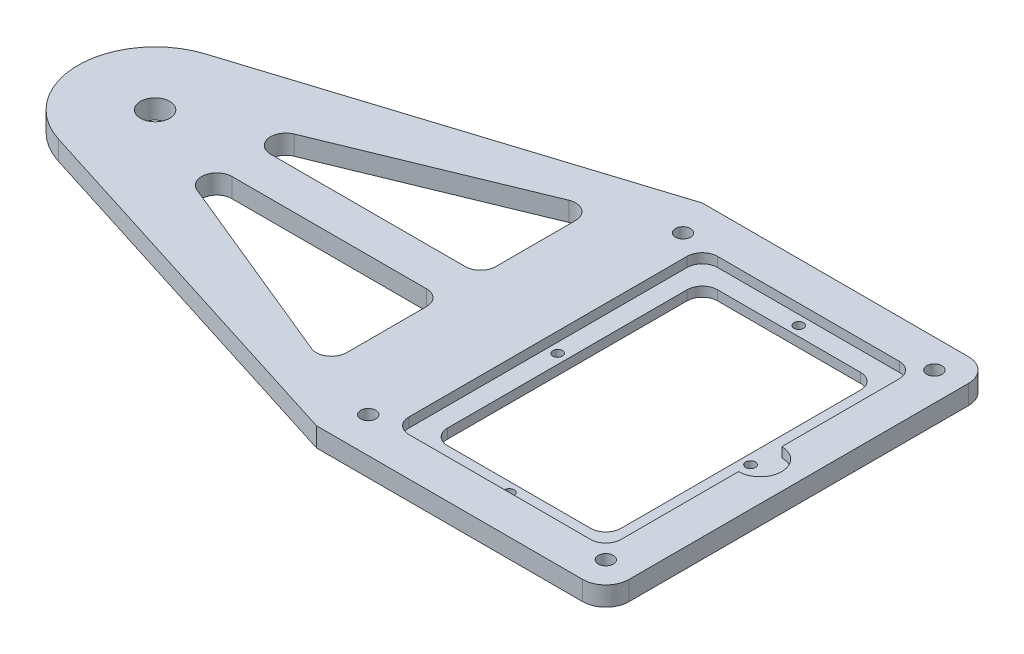
from build123d import *

# Parameters (mm, degrees)
SKETCH1_W           = 95.25
SKETCH1_H           = 127
BOSS_EXTRUDE1_DEPTH = 6.35
BOSS_EXTRUDE3_DEPTH = 6.35
SKETCH5_R           = 4.826
CUT_EXTRUDE1_DEPTH  = 201.11039673
CUT_EXTRUDE2_DEPTH  = 201.11039673
FILLET9_R           = 5
SKETCH7_R           = 5.453804141
BOSS_EXTRUDE4_DEPTH = 6.35
SKETCH8_W           = 69.85
SKETCH8_H           = 101.6
CUT_EXTRUDE3_DEPTH  = 3.175
SKETCH9_W           = 57.15
SKETCH9_H           = 88.9
CUT_EXTRUDE4_DEPTH  = 201.03481948
SKETCH11_R          = 1.5875
CUT_EXTRUDE6_DEPTH  = 201.03481948
CUT_EXTRUDE7_DEPTH  = 3.175
FILLET10_R          = 5
FILLET11_R          = 5
FILLET12_R          = 7.62
SKETCH13_R          = 2.4892
CUT_EXTRUDE8_DEPTH  = 201.11039673


with BuildPart() as part:
    # Sketch1 → Boss-Extrude1 (new body)
    with BuildSketch(Plane(origin=(0, 0, 0), x_dir=(1, 0, 0), z_dir=(0, 1, 0))):
        Rectangle(SKETCH1_W, SKETCH1_H)
    extrude(amount=BOSS_EXTRUDE1_DEPTH)

    # Sketch4 → Boss-Extrude3 (add)
    with BuildSketch(Plane(origin=(0, 6.35, 0), x_dir=(1, 0, 0), z_dir=(0, 1, 0))):
        with BuildLine():
            Line((-47.625, 63.5), (-171.916018217, 24.219268021))
            ThreePointArc((-171.916018217, 24.219268021), (-189.6618, 0), (-171.916018217, -24.219268021))
            Line((-171.916018217, -24.219268021), (-47.625, -63.5))
            Line((-47.625, -63.5), (-47.625, 63.5))
        make_face()
    extrude(amount=-BOSS_EXTRUDE3_DEPTH)

    # Sketch5 → Cut-Extrude1 (cut, through all)
    with BuildSketch(Plane(origin=(0, 6.35, 0), x_dir=(1, 0, 0), z_dir=(0, 1, 0))):
        with Locations((-164.2618, 0)):
            Circle(SKETCH5_R)
        with Locations((-8.6868, 0)):
            Circle(SKETCH5_R)
    extrude(amount=-CUT_EXTRUDE1_DEPTH, mode=Mode.SUBTRACT)

    # Sketch6 → Cut-Extrude2 (cut, through all)
    with BuildSketch(Plane(origin=(0, 6.35, 0), x_dir=(1, 0, 0), z_dir=(0, 1, 0))):
        Polygon((-63.5, 45.163743355), (-157.9118, 6.35), (-63.5, 6.35), align=None)
        Polygon((-63.5, -6.35), (-63.5, -45.163743355), (-157.9118, -6.35), align=None)
    extrude(amount=-CUT_EXTRUDE2_DEPTH, mode=Mode.SUBTRACT)

    # Fillet9
    fillet9_edges = [part.edges().sort_by_distance(p)[0] for p in [
        (-157.9118, 3.175, 6.35),
        (-63.5, 3.175, 6.35),
        (-63.5, 3.175, 45.163743355),
        (-63.5, 3.175, -6.35),
        (-157.9118, 3.175, -6.35),
        (-63.5, 3.175, -45.163743355),
    ]]
    fillet(fillet9_edges, radius=FILLET9_R)

    # Sketch7 → Boss-Extrude4 (add)
    with BuildSketch(Plane(origin=(0, 6.35, 0), x_dir=(1, 0, 0), z_dir=(0, 1, 0))):
        with Locations((-8.6868, 0)):
            Circle(SKETCH7_R)
    extrude(amount=-BOSS_EXTRUDE4_DEPTH)

    # Sketch8 → Cut-Extrude3 (cut)
    with BuildSketch(Plane(origin=(0, 6.35, 0), x_dir=(1, 0, 0), z_dir=(0, 1, 0))):
        Rectangle(SKETCH8_W, SKETCH8_H)
    extrude(amount=-CUT_EXTRUDE3_DEPTH, mode=Mode.SUBTRACT)

    # Sketch9 → Cut-Extrude4 (cut, through all)
    with BuildSketch(Plane(origin=(0, 3.175, 0), x_dir=(1, 0, 0), z_dir=(0, 1, 0))):
        Rectangle(SKETCH9_W, SKETCH9_H)
    extrude(amount=-CUT_EXTRUDE4_DEPTH, mode=Mode.SUBTRACT)

    # Sketch11 → Cut-Extrude6 (cut, through all)
    with BuildSketch(Plane(origin=(0, 3.175, 0), x_dir=(1, 0, 0), z_dir=(0, 1, 0))):
        with Locations((-31.75, 0)):
            Circle(SKETCH11_R)
        with Locations((31.75, 0)):
            Circle(SKETCH11_R)
        with Locations((0, 47.625)):
            Circle(SKETCH11_R)
        with Locations((0, -47.625)):
            Circle(SKETCH11_R)
    extrude(amount=-CUT_EXTRUDE6_DEPTH, mode=Mode.SUBTRACT)

    # Sketch12 → Cut-Extrude7 (cut)
    with BuildSketch(Plane(origin=(0, 6.35, 0), x_dir=(1, 0, 0), z_dir=(0, 1, 0))):
        with BuildLine():
            Line((34.925, 7.112), (34.925, -7.112))
            ThreePointArc((34.925, -7.112), (42.037, 0), (34.925, 7.112))
        make_face()
    extrude(amount=-CUT_EXTRUDE7_DEPTH, mode=Mode.SUBTRACT)

    # Fillet10
    fillet10_edges = [part.edges().sort_by_distance(p)[0] for p in [
        (-34.925, 4.7625, 50.8),
        (34.925, 4.7625, 50.8),
        (34.925, 4.7625, -50.8),
        (-34.925, 4.7625, -50.8),
    ]]
    fillet(fillet10_edges, radius=FILLET10_R)

    # Fillet11
    fillet11_edges = [part.edges().sort_by_distance(p)[0] for p in [
        (-28.575, 1.5875, -44.45),
        (28.575, 1.5875, -44.45),
        (28.575, 1.5875, 44.45),
        (-28.575, 1.5875, 44.45),
    ]]
    fillet(fillet11_edges, radius=FILLET11_R)

    # Fillet12
    fillet12_edges = [part.edges().sort_by_distance(p)[0] for p in [
        (47.625, 3.175, -63.5),
        (47.625, 3.175, 63.5),
    ]]
    fillet(fillet12_edges, radius=FILLET12_R)

    # Sketch13 → Cut-Extrude8 (cut, through all)
    with BuildSketch(Plane(origin=(0, 6.35, 0), x_dir=(1, 0, 0), z_dir=(0, 1, 0))):
        with Locations((-42.286053483, 51.811053483)):
            Circle(SKETCH13_R)
        with Locations((-42.286053483, -51.811053483)):
            Circle(SKETCH13_R)
        with Locations((38.202339924, -54.077339924)):
            Circle(SKETCH13_R)
        with Locations((38.202339924, 54.077339924)):
            Circle(SKETCH13_R)
    extrude(amount=-CUT_EXTRUDE8_DEPTH, mode=Mode.SUBTRACT)


solid = part.part
